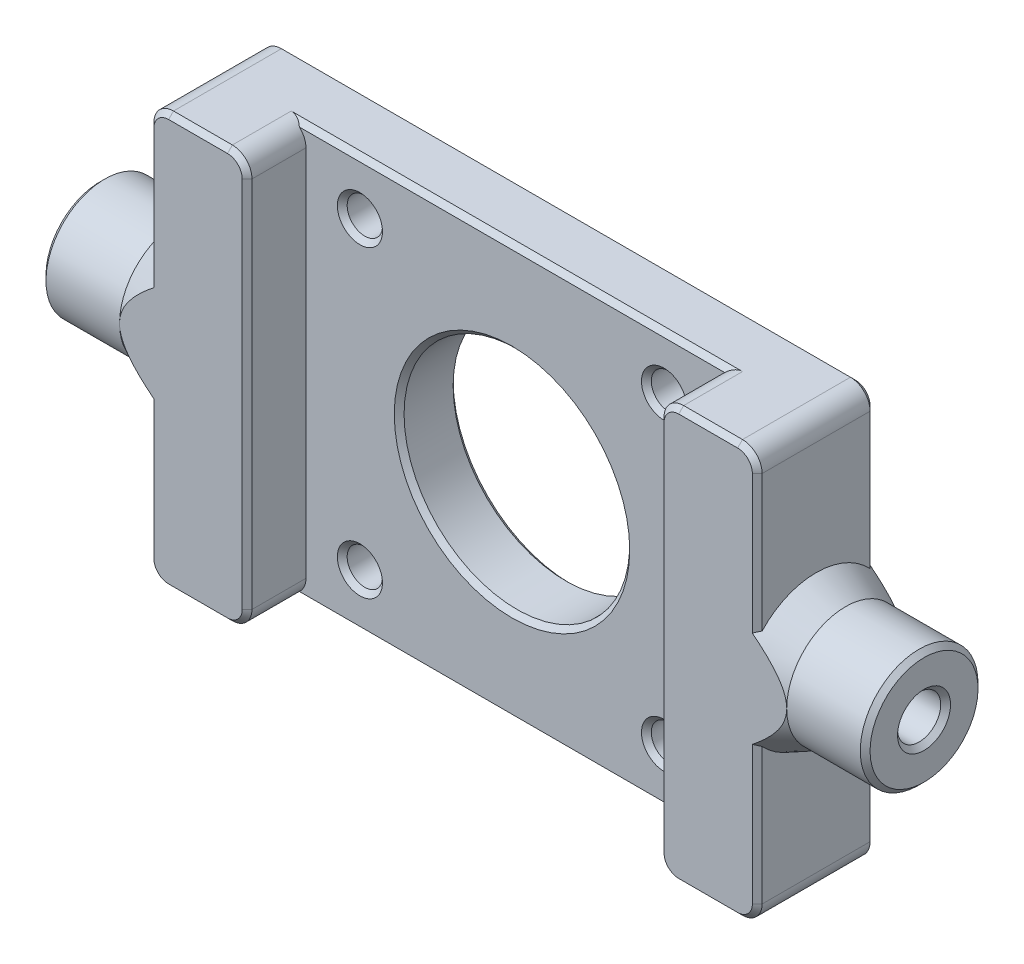
from build123d import *

# Parameters (mm, degrees)
AUFSATZ_LINEAR_AUSTRAGEN1_DEPTH = 6
SKIZZE2_W                       = 10
SKIZZE2_H                       = 42
AUFSATZ_LINEAR_AUSTRAGEN2_DEPTH = 6
SKIZZE3_R                       = 6
AUFSATZ_LINEAR_AUSTRAGEN3_DEPTH = 11
SKIZZE5_R                       = 2.2
SCHNITT_LINEAR_AUSTRAGEN2_DEPTH = 10
SKIZZE4_R                       = 11.5
SKIZZE4_R_2                     = 1.8
SCHNITT_LINEAR_AUSTRAGEN1_DEPTH = 8
FASE1_SIZE                      = 1.5
FASE1_SIZE_2                    = 3
FASE2_SIZE                      = 1.5
FASE2_SIZE_2                    = 3
VERRUNDUNG1_R                   = 2
FASE3_SIZE                      = 0.5


with BuildPart() as part:
    # Skizze1 → Aufsatz-Linear austragen1 (new body)
    with BuildSketch(Plane.XY):
        Polygon((21, 21), (31, 21), (31, -21), (21, -21), (-21, -21), (-31, -21), (-31, 21), (-21, 21), align=None)
    extrude(amount=AUFSATZ_LINEAR_AUSTRAGEN1_DEPTH)

    # Skizze2 → Aufsatz-Linear austragen2 (add)
    with BuildSketch(Plane.XY.offset(6)):
        with Locations((26, 0)):
            Rectangle(SKIZZE2_W, SKIZZE2_H)
        with Locations((-26, 0)):
            Rectangle(SKIZZE2_W, SKIZZE2_H)
    extrude(amount=AUFSATZ_LINEAR_AUSTRAGEN2_DEPTH)

    # Skizze3 → Aufsatz-Linear austragen3 (add)
    with BuildSketch(Plane(origin=(31, 0, 0), x_dir=(0, 0, -1), z_dir=(1, 0, 0))):
        with Locations((-6, 0)):
            Circle(SKIZZE3_R)
    aufsatz_linear_austragen3 = extrude(amount=AUFSATZ_LINEAR_AUSTRAGEN3_DEPTH)

    # Skizze5 → Schnitt-Linear austragen2 (cut)
    with BuildSketch(Plane(origin=(42, 0, 0), x_dir=(0, 0, -1), z_dir=(1, 0, 0))):
        with Locations(Location((-6, 0, 0), (0, 0, 90))):
            Circle(SKIZZE5_R)
    schnitt_linear_austragen2 = extrude(amount=-SCHNITT_LINEAR_AUSTRAGEN2_DEPTH, mode=Mode.SUBTRACT)

    # Spiegeln1: Aufsatz-Linear austragen3, Schnitt-Linear austragen2 across plane
    add(aufsatz_linear_austragen3.mirror(Plane(origin=(0, 0, 0), x_dir=(0, 0, 1), z_dir=(1, 0, 0))))
    add(schnitt_linear_austragen2.mirror(Plane(origin=(0, 0, 0), x_dir=(0, 0, 1), z_dir=(1, 0, 0))), mode=Mode.SUBTRACT)

    # Skizze4 → Schnitt-Linear austragen1 (cut)
    with BuildSketch(Plane.XY.offset(6)):
        Circle(SKIZZE4_R)
        with Locations((-15.5, 15.5)):
            Circle(SKIZZE4_R_2)
        with Locations((15.5, 15.5)):
            Circle(SKIZZE4_R_2)
        with Locations((15.5, -15.5)):
            Circle(SKIZZE4_R_2)
        with Locations((-15.5, -15.5)):
            Circle(SKIZZE4_R_2)
    extrude(amount=-SCHNITT_LINEAR_AUSTRAGEN1_DEPTH, mode=Mode.SUBTRACT)

    # Fase1
    # the kernel refuses this chamfer: 3, 1.5 mm, written as the material it adds along each edge
    with BuildSketch(Plane(origin=(31, 0, 6), x_dir=(0, 0, -1), z_dir=(0, -1, 0))) as fase1_piece_1_section:
        Polygon((6 + FASE1_SIZE, 0), (6, FASE1_SIZE_2), (6, 0), align=None)
    fase1_piece_1 = revolve(axis=Axis((31, 0, 6), (1, 0, 0)), revolution_arc=179.999999686, mode=Mode.PRIVATE)
    fase1_piece_1 = split(fase1_piece_1, bisect_by=Plane(origin=(32.485350769, 6.720701537, 0), z_dir=(0, 0, 1)), keep=Keep.TOP, mode=Mode.PRIVATE)
    fase1_piece_1 = split(fase1_piece_1, bisect_by=Plane(origin=(32.485350769, 6.720701537, 12), z_dir=(0, 0, -1)), keep=Keep.TOP, mode=Mode.PRIVATE)
    add(fase1_piece_1)
    with BuildSketch(Plane(origin=(31, 0, 6), x_dir=(0, 5.472961761905791e-09, 1.0), z_dir=(0, 1.0, -5.472961761905791e-09))) as fase1_piece_2_section:
        Polygon((6 + FASE1_SIZE, 0), (6, FASE1_SIZE_2), (6, 0), align=None)
    fase1_piece_2 = revolve(axis=Axis((31, 0, 6), (1, 0, 0)), revolution_arc=180.000000314, mode=Mode.PRIVATE)
    fase1_piece_2 = split(fase1_piece_2, bisect_by=Plane(origin=(32.485350772, -6.720701535, 0), z_dir=(0, 0, 1)), keep=Keep.TOP, mode=Mode.PRIVATE)
    fase1_piece_2 = split(fase1_piece_2, bisect_by=Plane(origin=(32.485350772, -6.720701535, 12), z_dir=(0, 0, -1)), keep=Keep.TOP, mode=Mode.PRIVATE)
    add(fase1_piece_2)

    # Fase2
    # the kernel refuses this chamfer: 3, 1.5 mm, written as the material it adds along each edge
    with BuildSketch(Plane(origin=(-31, 0, 6), x_dir=(0, 0, -1), z_dir=(0, -1, 0))) as fase2_piece_1_section:
        Polygon((6 + FASE2_SIZE, 0), (6, -FASE2_SIZE_2), (6, 0), align=None)
    fase2_piece_1 = revolve(axis=Axis((-31, 0, 6), (1, 0, 0)), revolution_arc=179.999999686, mode=Mode.PRIVATE)
    fase2_piece_1 = split(fase2_piece_1, bisect_by=Plane(origin=(-32.485350769, 6.720701537, 0), z_dir=(0, 0, 1)), keep=Keep.TOP, mode=Mode.PRIVATE)
    fase2_piece_1 = split(fase2_piece_1, bisect_by=Plane(origin=(-32.485350769, 6.720701537, 12), z_dir=(0, 0, -1)), keep=Keep.TOP, mode=Mode.PRIVATE)
    add(fase2_piece_1)
    with BuildSketch(Plane(origin=(-31, 0, 6), x_dir=(0, 5.472961761905791e-09, 1.0), z_dir=(0, 1.0, -5.472961761905791e-09))) as fase2_piece_2_section:
        Polygon((6 + FASE2_SIZE, 0), (6, -FASE2_SIZE_2), (6, 0), align=None)
    fase2_piece_2 = revolve(axis=Axis((-31, 0, 6), (1, 0, 0)), revolution_arc=180.000000314, mode=Mode.PRIVATE)
    fase2_piece_2 = split(fase2_piece_2, bisect_by=Plane(origin=(-32.485350772, -6.720701535, 0), z_dir=(0, 0, 1)), keep=Keep.TOP, mode=Mode.PRIVATE)
    fase2_piece_2 = split(fase2_piece_2, bisect_by=Plane(origin=(-32.485350772, -6.720701535, 12), z_dir=(0, 0, -1)), keep=Keep.TOP, mode=Mode.PRIVATE)
    add(fase2_piece_2)

    # Verrundung1
    verrundung1_edges = [part.edges().sort_by_distance(p)[0] for p in [
        (31, 21, 6),
        (31, -21, 6),
        (-31, -21, 6),
        (-31, 21, 6),
        (21, -21, 9),
        (21, 21, 9),
        (-21, 21, 9),
        (-21, -21, 9),
    ]]
    fillet(verrundung1_edges, radius=VERRUNDUNG1_R)

    # Fase3
    fase3_edges = [part.edges().sort_by_distance(p)[0] for p in [
        (-31, -11.75, 0),
        (-31, 11.75, 12),
        (-21, 0, 12),
        (0, -21, 0),
        (26, -21, 12),
        (-26, -21, 12),
        (-26, 21, 12),
        (-31, -11.75, 12),
        (-30.414213562, 20.414213562, 12),
        (-30.414213562, -20.414213562, 12),
        (-21.585786438, 20.414213562, 12),
        (-21.585786438, -20.414213562, 12),
        (21, 0, 12),
        (31, 11.75, 12),
        (26, 21, 12),
        (30.414213562, 20.414213562, 12),
        (30.414213562, -20.414213562, 12),
        (21.585786438, 20.414213562, 12),
        (21.585786438, -20.414213562, 12),
        (0, 21, 0),
        (-31, 11.75, 0),
        (31, -11.75, 0),
        (30.414213562, 20.414213562, 0),
        (-30.414213562, 20.414213562, 0),
        (30.414213562, -20.414213562, 0),
        (-30.414213562, -20.414213562, 0),
        (0, 21, 6),
        (0, -21, 6),
        (42, 0, 12),
        (42, -2.2, 6),
        (-42, 0, 12),
        (-42, -2.2, 6),
        (-17.3, -15.5, 0),
        (-17.3, -15.5, 6),
        (13.7, -15.5, 0),
        (13.7, -15.5, 6),
        (13.7, 15.5, 0),
        (13.7, 15.5, 6),
        (-17.3, 15.5, 0),
        (-17.3, 15.5, 6),
        (-11.5, 0, 0),
        (-11.5, 0, 6),
        (31, -11.75, 12),
        (31, 11.75, 0),
    ]]
    chamfer(fase3_edges, length=FASE3_SIZE)


solid = part.part
